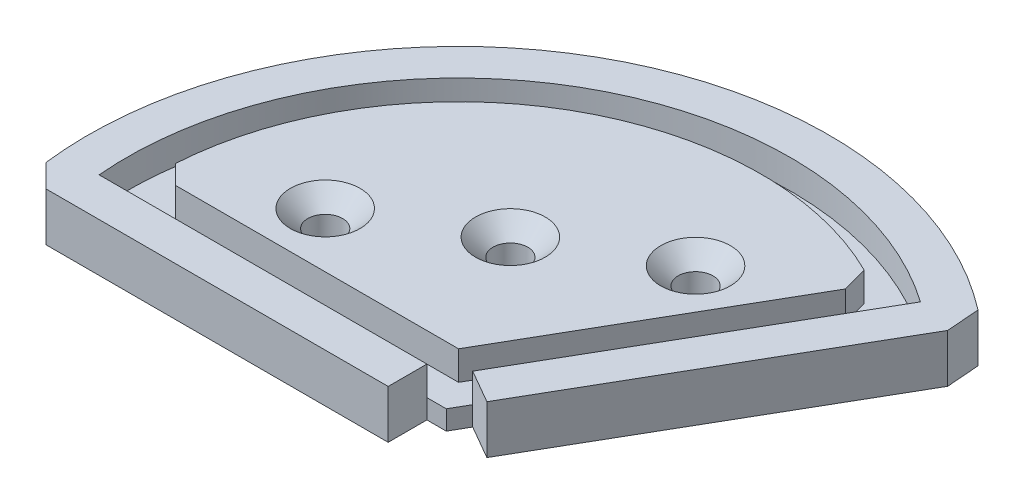
from build123d import *

# Parameters (mm, degrees)
BOSS_EXTRUDE8_DEPTH                                  = 1.5
BOSS_EXTRUDE9_START                                  = -1.5
BOSS_EXTRUDE9_DEPTH                                  = 1.5
BOSS_EXTRUDE10_DEPTH                                 = 1
CHAMFER2_SIZE                                        = 1
CUT_EXTRUDE6_DEPTH                                   = 28.162128967
CHAMFER5_SIZE                                        = 1.249835708
CHAMFER5_SIZE_2                                      = 1
CSK_FOR_M1_6_COUNTERSUNK_FLAT_HEAD_SCREW_D           = 1.8
CSK_FOR_M1_6_COUNTERSUNK_FLAT_HEAD_SCREW_DEPTH       = 2.5
CSK_FOR_M1_6_COUNTERSUNK_FLAT_HEAD_SCREW_CSINK_D     = 3.6
CSK_FOR_M1_6_COUNTERSUNK_FLAT_HEAD_SCREW_CSINK_ANGLE = 90
CSK_FOR_M1_6_COUNTERSUNK_FLAT_HEAD_SCREW_TIP         = 0.540774557


with BuildPart() as part:
    # Sketch15 → Boss-Extrude8 (new body)
    with BuildSketch(Plane(origin=(0, 0, 0), x_dir=(1, 0, 0), z_dir=(0, 1, 0))):
        with BuildLine():
            Line((0, 0), (-15.625, 0))
            ThreePointArc((-15.625, 0), (-7.8125, 13.531646934), (7.8125, 13.531646934))
            Line((7.8125, 13.531646934), (0, 0))
        make_face()
    extrude(amount=BOSS_EXTRUDE8_DEPTH)



with BuildPart() as body_2:
    # Sketch16 → Boss-Extrude9 (new body)
    with BuildSketch(Plane(origin=(0, 1.5, 0), x_dir=(1, 0, 0), z_dir=(0, 1, 0)).offset(BOSS_EXTRUDE9_START)):
        with BuildLine():
            Line((2.020725942, -3.5), (12.432094511, 14.533019338))
            ThreePointArc((12.432094511, 14.533019338), (-9.5625, 16.562735847), (-18.802011196, -3.5))
            Line((-18.802011196, -3.5), (2.020725942, -3.5))
        make_face()
        with BuildLine():
            Line((0.866025404, -1.5), (9.828628146, 14.023683317))
            ThreePointArc((9.828628146, 14.023683317), (-8.5625, 14.83068504), (-17.05918008, -1.5))
            Line((-17.05918008, -1.5), (0.866025404, -1.5))
        make_face(mode=Mode.SUBTRACT)
    extrude(amount=BOSS_EXTRUDE9_DEPTH)


with BuildPart() as part_1:
    add(part.part)

    add(body_2.part)  # Boss-Extrude10 merges body 2
    # Sketch17 → Boss-Extrude10 (add)
    with BuildSketch(Plane.XZ):
        with BuildLine():
            Line((12.432094511, -14.533019338), (2.020725942, 3.5))
            Line((2.020725942, 3.5), (-18.802011196, 3.5))
            ThreePointArc((-18.802011196, 3.5), (-9.5625, -16.562735847), (12.432094511, -14.533019338))
        make_face()
    extrude(amount=BOSS_EXTRUDE10_DEPTH)

    # Chamfer2
    # the kernel refuses this chamfer: 1 mm, written as the material it takes off along each edge
    with BuildSketch(Plane(origin=(-15.625, 0, 0), x_dir=(1, 0, 0), z_dir=(0, 1, 0))) as chamfer2_piece_1:
        with BuildLine():
            Line((CHAMFER2_SIZE, 0), (0.030129793, 0.969870207))
            ThreePointArc((0.030129793, 0.969870207), (0.007965345, 0.498852279), (0, 0))
            Line((0, 0), (CHAMFER2_SIZE, 0))
        make_face()
    extrude(amount=4.071682988, mode=Mode.SUBTRACT)
    with BuildSketch(Plane(origin=(7.8125, 0, -13.531646934), x_dir=(-0.8811332220086912, 0, -0.4728681053661608), z_dir=(0, 1, 0))) as chamfer2_piece_2:
        with BuildLine():
            Line((0.970338097, 0), (CHAMFER2_SIZE * 0.0310508191178, CHAMFER2_SIZE * 0.999517807061))
            Line((CHAMFER2_SIZE * 0.0310508191178, CHAMFER2_SIZE * 0.999517807061), (0, 0))
            ThreePointArc((0, 0), (0.498859067, -0.007528267), (0.970338097, 0))
        make_face()
    extrude(amount=4.071682988, mode=Mode.SUBTRACT)

    # Sketch19 → Cut-Extrude6 (cut, through all)
    with BuildSketch(Plane(origin=(0, 1.5, 0), x_dir=(1, 0, 0), z_dir=(0, 1, 0))):
        Polygon((-0.133974596, -1.5), (-0.133974596, -3.5), (2.020725942, -3.5), (3.098076211, -1.633974596), (1.366025404, -0.633974596), (0.866025404, -1.5), align=None)
    extrude(amount=-CUT_EXTRUDE6_DEPTH, mode=Mode.SUBTRACT)

    # Chamfer5
    # the kernel refuses this chamfer: 1.249835708, 1 mm, written as the material it takes off along each edge
    with BuildSketch(Plane(origin=(12.432094511, -4.228421452, -14.533019338), x_dir=(-0.500000000000006, 0, 0.8660254037844353), z_dir=(0, 1, 0))) as chamfer5_piece_1:
        with BuildLine():
            Line((CHAMFER5_SIZE, 0), (-0.153998799, -0.963208706))
            ThreePointArc((-0.153998799, -0.963208706), (-0.08585038, -0.497615929), (0, 0))
            Line((0, 0), (CHAMFER5_SIZE, 0))
        make_face()
    extrude(amount=8.956842905, mode=Mode.SUBTRACT)
    with BuildSketch(Plane(origin=(-18.802011196, -4.09148885, 3.5), x_dir=(-0.1521791167983569, 0, -0.9883529310982349), z_dir=(0, 1, 0))) as chamfer5_piece_2:
        with BuildLine():
            Line((1.195923602, 0), (-CHAMFER5_SIZE_2 * 0.152179116798, -CHAMFER5_SIZE_2 * 0.988352931098))
            Line((-CHAMFER5_SIZE_2 * 0.152179116798, -CHAMFER5_SIZE_2 * 0.988352931098), (0, 0))
            ThreePointArc((0, 0), (0.618115367, 0.009339597), (1.195923602, 0))
        make_face()
    extrude(amount=8.6829777, mode=Mode.SUBTRACT)

    # CSK for M1.6 Countersunk Flat Head Screw1
    with Locations(Plane(origin=(0, 1.5, 0), x_dir=(1, 0, 0), z_dir=(0, 1, 0))):
        with Locations((-3.65625, 6.332810765), (-9.718427826, 2.832810765), (2.405927826, 9.832810765)):
            CounterSinkHole(CSK_FOR_M1_6_COUNTERSUNK_FLAT_HEAD_SCREW_D / 2, CSK_FOR_M1_6_COUNTERSUNK_FLAT_HEAD_SCREW_CSINK_D / 2, depth=CSK_FOR_M1_6_COUNTERSUNK_FLAT_HEAD_SCREW_DEPTH, counter_sink_angle=CSK_FOR_M1_6_COUNTERSUNK_FLAT_HEAD_SCREW_CSINK_ANGLE)
            with Locations((0, 0, -(CSK_FOR_M1_6_COUNTERSUNK_FLAT_HEAD_SCREW_DEPTH + CSK_FOR_M1_6_COUNTERSUNK_FLAT_HEAD_SCREW_TIP / 2))):  # 118° drill point
                Cone(0, CSK_FOR_M1_6_COUNTERSUNK_FLAT_HEAD_SCREW_D / 2, CSK_FOR_M1_6_COUNTERSUNK_FLAT_HEAD_SCREW_TIP, mode=Mode.SUBTRACT)


solid = part_1.part
